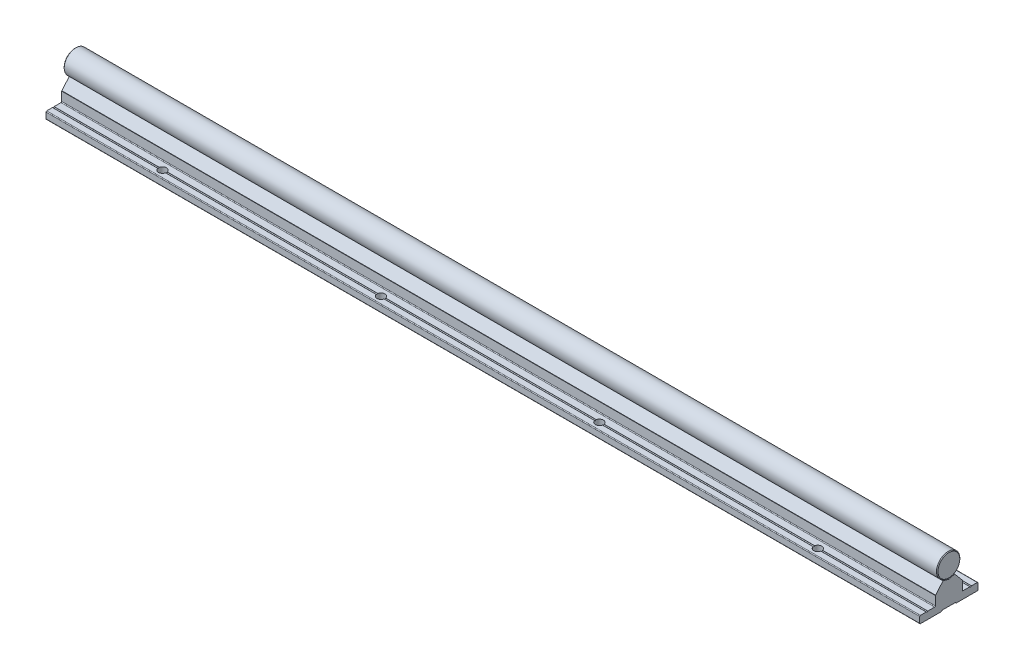
from build123d import *

# Parameters (mm, degrees)
EXTRUDE_3847_DEPTH       = 1500
SKETCH_1_3_R             = 8
EXTRUDE_3976_DEPTH       = 1500
FILLET_4_R               = 0.2
SKETCH_2_R               = 2.75
CUT_EXTRUDE_1_DEPTH      = 1501.39461476
PATTERN_LINEAR_1_COUNT   = 20
PATTERN_LINEAR_1_PITCH   = 150
PATTERN_LINEAR_2_COUNT   = 20
PATTERN_LINEAR_2_PITCH   = 150
FILLET_1_R               = 0.3
CUT_EXTRUDE_2_DEPTH      = 3
FILLET_2_R               = 0.3
PATTERN_LINEAR_3_COUNT   = 20
PATTERN_LINEAR_3_PITCH   = 150
CHAMFER_1_SIZE           = 0.5
FILLET_3_R               = 0.5
FILLET_5_R               = 0.2
FILLET_6_R               = 0.1
FILLET_7_R               = 0.1
CUT_EXTRUDE_3_DEPTH      = 1501.341627866
CUT_EXTRUDE_3_DEPTH_BACK = 1501.341627866
SKETCH_7_W               = 3500
SKETCH_7_H               = 1500
SKETCH_7_W_2             = 600
SKETCH_7_H_2             = 1000
CHAMFER_2_SIZE           = 0.5


with BuildPart() as part:
    # Эскиз1 → Extrude 3847 (new, symmetric)
    with BuildSketch(Plane(origin=(0, 0, 0), x_dir=(0, 0, -1), z_dir=(1, 0, 0))):
        Polygon((-20, -25), (-4.75, -25), (-4.75, -24.4), (4.75, -24.4), (4.75, -25), (20, -25), (20, -20), (15.5, -20), (15, -20.5), (14.5, -20), (9.25, -20), (9.25, -13.3), (9.110116754, -13.3), (4, -7.21), (3.8, -7.21), (2.309327639, -7.659439004), (0, -8.355703281), (-2.309327657, -7.659438999), (-3.8, -7.21), (-4, -7.21), (-9.110116754, -13.3), (-9.25, -13.3), (-9.25, -20), (-14.5, -20), (-15, -20.5), (-15.5, -20), (-20, -20), align=None)
    extrude(amount=EXTRUDE_3847_DEPTH, both=True)

    # Скругление4
    fillet_4_edges = [part.edges().sort_by_distance(p)[0] for p in [
        (0, -20, -15.5),
        (0, -24.4, -4.75),
        (0, -24.4, 4.75),
        (0, -20, 15.5),
        (0, -20, 14.5),
        (0, -8.355703281, 0),
        (0, -20, -14.5),
    ]]
    fillet(fillet_4_edges, radius=FILLET_4_R)

    # Эскиз2 → Вырез-Вытянуть1 (cut, through all)
    with BuildSketch(Plane(origin=(0, -20, 0), x_dir=(1, 0, 0), z_dir=(0, 1, 0))):
        with Locations(Location((-1425, -15, 0), (0, 0, 270))):
            Circle(SKETCH_2_R)
        with Locations(Location((-1425, 15, 0), (0, 0, 270))):
            Circle(SKETCH_2_R)
        with Locations(Location((-1275, -15, 0), (0, 0, 270))):
            Circle(SKETCH_2_R)
        with Locations(Location((-1275, 15, 0), (0, 0, 270))):
            Circle(SKETCH_2_R)
        with Locations(Location((-1125, -15, 0), (0, 0, 270))):
            Circle(SKETCH_2_R)
        with Locations(Location((-1125, 15, 0), (0, 0, 270))):
            Circle(SKETCH_2_R)
        with Locations(Location((-975, -15, 0), (0, 0, 270))):
            Circle(SKETCH_2_R)
        with Locations(Location((-975, 15, 0), (0, 0, 270))):
            Circle(SKETCH_2_R)
        with Locations(Location((-825, -15, 0), (0, 0, 270))):
            Circle(SKETCH_2_R)
        with Locations(Location((-825, 15, 0), (0, 0, 270))):
            Circle(SKETCH_2_R)
        with Locations(Location((-675, -15, 0), (0, 0, 270))):
            Circle(SKETCH_2_R)
        with Locations(Location((-675, 15, 0), (0, 0, 270))):
            Circle(SKETCH_2_R)
        with Locations(Location((-525, -15, 0), (0, 0, 270))):
            Circle(SKETCH_2_R)
        with Locations(Location((-525, 15, 0), (0, 0, 270))):
            Circle(SKETCH_2_R)
        with Locations(Location((-375, -15, 0), (0, 0, 270))):
            Circle(SKETCH_2_R)
        with Locations(Location((-375, 15, 0), (0, 0, 270))):
            Circle(SKETCH_2_R)
        with Locations(Location((-225, -15, 0), (0, 0, 270))):
            Circle(SKETCH_2_R)
        with Locations(Location((-225, 15, 0), (0, 0, 270))):
            Circle(SKETCH_2_R)
        with Locations(Location((-75, -15, 0), (0, 0, 270))):
            Circle(SKETCH_2_R)
        with Locations(Location((-75, 15, 0), (0, 0, 270))):
            Circle(SKETCH_2_R)
        with Locations(Location((75, -15, 0), (0, 0, 270))):
            Circle(SKETCH_2_R)
        with Locations(Location((75, 15, 0), (0, 0, 270))):
            Circle(SKETCH_2_R)
        with Locations(Location((225, -15, 0), (0, 0, 270))):
            Circle(SKETCH_2_R)
        with Locations(Location((225, 15, 0), (0, 0, 270))):
            Circle(SKETCH_2_R)
        with Locations(Location((375, -15, 0), (0, 0, 270))):
            Circle(SKETCH_2_R)
        with Locations(Location((375, 15, 0), (0, 0, 270))):
            Circle(SKETCH_2_R)
        with Locations(Location((525, -15, 0), (0, 0, 270))):
            Circle(SKETCH_2_R)
        with Locations(Location((525, 15, 0), (0, 0, 270))):
            Circle(SKETCH_2_R)
        with Locations(Location((675, -15, 0), (0, 0, 270))):
            Circle(SKETCH_2_R)
        with Locations(Location((675, 15, 0), (0, 0, 270))):
            Circle(SKETCH_2_R)
        with Locations(Location((825, -15, 0), (0, 0, 270))):
            Circle(SKETCH_2_R)
        with Locations(Location((825, 15, 0), (0, 0, 270))):
            Circle(SKETCH_2_R)
        with Locations(Location((975, -15, 0), (0, 0, 270))):
            Circle(SKETCH_2_R)
        with Locations(Location((975, 15, 0), (0, 0, 270))):
            Circle(SKETCH_2_R)
        with Locations(Location((1125, -15, 0), (0, 0, 270))):
            Circle(SKETCH_2_R)
        with Locations(Location((1125, 15, 0), (0, 0, 270))):
            Circle(SKETCH_2_R)
        with Locations(Location((1275, -15, 0), (0, 0, 270))):
            Circle(SKETCH_2_R)
        with Locations(Location((1275, 15, 0), (0, 0, 270))):
            Circle(SKETCH_2_R)
        with Locations(Location((1425, -15, 0), (0, 0, 270))):
            Circle(SKETCH_2_R)
        with Locations(Location((1425, 15, 0), (0, 0, 270))):
            Circle(SKETCH_2_R)
    extrude(amount=-CUT_EXTRUDE_1_DEPTH, mode=Mode.SUBTRACT)

    # Эскиз3 → Вырез-Повернуть1 (revolve, cut)
    with BuildSketch(Plane.XY, mode=Mode.PRIVATE) as cut_revolve_1_sk:
        Polygon((-1425, 0), (-1427.2, -1.270170592), (-1427.2, -7.5), (-1427.75, -7.5), (-1427.75, -19), (-1429.75, -19), (-1429.75, -24.4), (-1425, -24.4), align=None)
    cut_revolve_1 = revolve(cut_revolve_1_sk.sketch.rotate(Axis((-1425, 56.434869358, 0), (0, -1, 0)), 270), axis=Axis((-1425, 56.434869358, 0), (0, -1, 0)), mode=Mode.SUBTRACT)

    # Линейный массив1: Вырез-Повернуть1 ×20
    with Locations(*[(i * PATTERN_LINEAR_1_PITCH, 0, 0) for i in range(1, PATTERN_LINEAR_1_COUNT)]):
        add(cut_revolve_1, mode=Mode.SUBTRACT)

    # Скругление3
    fillet_3_edges = [part.edges().sort_by_distance(p)[0] for p in [
        (0, -20, -9.25),
        (0, -20, -20),
        (0, -25, -20),
        (0, -25, -4.75),
        (0, -25, 4.75),
        (0, -20, 9.25),
        (0, -25, 20),
        (0, -20, 20),
    ]]
    fillet(fillet_3_edges, radius=FILLET_3_R)

    # Скругление5
    fillet_5_edges = [part.edges().sort_by_distance(p)[0] for p in [
        (0, -7.21, 4),
        (0, -7.21, 3.8),
        (0, -7.21, -3.8),
        (0, -7.21, -4),
    ]]
    fillet(fillet_5_edges, radius=FILLET_5_R)

    # Скругление6
    fillet_6_edges = [part.edges().sort_by_distance(p)[0] for p in [
        (0, -13.3, 9.25),
        (0, -13.3, -9.25),
    ]]
    fillet(fillet_6_edges, radius=FILLET_6_R)

    # Скругление7
    fillet_7_edges = [part.edges().sort_by_distance(p)[0] for p in [
        (0, -13.3, 9.110116754),
        (0, -13.3, -9.110116754),
    ]]
    fillet(fillet_7_edges, radius=FILLET_7_R)


with BuildPart() as body_2:
    # Эскиз1<3> → Extrude 3976 (new, symmetric)
    with BuildSketch(Plane(origin=(0, 0, 0), x_dir=(0, 0, -1), z_dir=(1, 0, 0))):
        Circle(SKETCH_1_3_R)
    extrude(amount=EXTRUDE_3976_DEPTH, both=True)

    # Эскиз4 → Вырез-Повернуть2 (revolve, cut)
    with BuildSketch(Plane.XY, mode=Mode.PRIVATE) as cut_revolve_2_sk:
        Polygon((-1425, -10), (-1427.2, -10), (-1427.2, -1.270170592), (-1425, 0), align=None)
    cut_revolve_2 = revolve(cut_revolve_2_sk.sketch.rotate(Axis((-1425, 39.840222878, 0), (0, -1, 0)), 270), axis=Axis((-1425, 39.840222878, 0), (0, -1, 0)), mode=Mode.SUBTRACT)

    # Линейный массив2: Вырез-Повернуть2 ×20
    with Locations(*[(i * PATTERN_LINEAR_2_PITCH, 0, 0) for i in range(1, PATTERN_LINEAR_2_COUNT)]):
        add(cut_revolve_2, mode=Mode.SUBTRACT)

    # Фаска1
    chamfer_1_edges = [body_2.edges().sort_by_distance(p)[0] for p in [
        (-1500, 0, 8),
        (1500, 0, 8),
    ]]
    chamfer(chamfer_1_edges, length=CHAMFER_1_SIZE)


with BuildPart() as body_3:
    # Эскиз5 → Повернуть1 (revolve)
    with BuildSketch(Plane.XY, mode=Mode.PRIVATE) as revolve_1_sk:
        Polygon((-1425, -24), (-1429.5, -24), (-1429.5, -19), (-1427.5, -19), (-1427.5, -2.461880215), (-1426.7, -2), (-1425, -2), align=None)
    revolve(revolve_1_sk.sketch.rotate(Axis((-1425, 35.529626596, 0), (0, -1, 0)), 270), axis=Axis((-1425, 35.529626596, 0), (0, -1, 0)))

    # Скругление1
    fillet_1_edges = [body_3.edges().sort_by_distance(p)[0] for p in [
        (-1425, -19, -4.5),
    ]]
    fillet(fillet_1_edges, radius=FILLET_1_R)

    # Эскиз6 → Вырез-Вытянуть2 (cut)
    with BuildSketch(Plane.XZ.offset(24)):
        Polygon((-1423.25, -1.010362971), (-1423.25, 1.010362971), (-1425, 2.020725942), (-1426.75, 1.010362971), (-1426.75, -1.010362971), (-1425, -2.020725942), align=None)
    extrude(amount=-CUT_EXTRUDE_2_DEPTH, mode=Mode.SUBTRACT)

    # Скругление2
    fillet_2_edges = [body_3.edges().sort_by_distance(p)[0] for p in [
        (-1424.125, -24, -1.515544457),
        (-1423.25, -24, 0),
        (-1424.125, -24, 1.515544457),
        (-1425.875, -24, 1.515544457),
        (-1426.75, -24, 0),
        (-1425.875, -24, -1.515544457),
        (-1425, -24, -4.5),
    ]]
    fillet(fillet_2_edges, radius=FILLET_2_R)


with BuildPart() as pattern_linear_3_1:
    # Линейный массив3: pattern copy
    add(body_3.part.moved(Location(Vector(1, 0, 0) * (1 * PATTERN_LINEAR_3_PITCH))))


with BuildPart() as pattern_linear_3_2:
    # Линейный массив3: pattern copy
    add(body_3.part.moved(Location(Vector(1, 0, 0) * (2 * PATTERN_LINEAR_3_PITCH))))


with BuildPart() as pattern_linear_3_3:
    # Линейный массив3: pattern copy
    add(body_3.part.moved(Location(Vector(1, 0, 0) * (3 * PATTERN_LINEAR_3_PITCH))))


with BuildPart() as pattern_linear_3_4:
    # Линейный массив3: pattern copy
    add(body_3.part.moved(Location(Vector(1, 0, 0) * (4 * PATTERN_LINEAR_3_PITCH))))


with BuildPart() as pattern_linear_3_5:
    # Линейный массив3: pattern copy
    add(body_3.part.moved(Location(Vector(1, 0, 0) * (5 * PATTERN_LINEAR_3_PITCH))))


with BuildPart() as pattern_linear_3_6:
    # Линейный массив3: pattern copy
    add(body_3.part.moved(Location(Vector(1, 0, 0) * (6 * PATTERN_LINEAR_3_PITCH))))


with BuildPart() as pattern_linear_3_7:
    # Линейный массив3: pattern copy
    add(body_3.part.moved(Location(Vector(1, 0, 0) * (7 * PATTERN_LINEAR_3_PITCH))))


with BuildPart() as pattern_linear_3_8:
    # Линейный массив3: pattern copy
    add(body_3.part.moved(Location(Vector(1, 0, 0) * (8 * PATTERN_LINEAR_3_PITCH))))


with BuildPart() as pattern_linear_3_9:
    # Линейный массив3: pattern copy
    add(body_3.part.moved(Location(Vector(1, 0, 0) * (9 * PATTERN_LINEAR_3_PITCH))))


with BuildPart() as pattern_linear_3_10:
    # Линейный массив3: pattern copy
    add(body_3.part.moved(Location(Vector(1, 0, 0) * (10 * PATTERN_LINEAR_3_PITCH))))


with BuildPart() as pattern_linear_3_11:
    # Линейный массив3: pattern copy
    add(body_3.part.moved(Location(Vector(1, 0, 0) * (11 * PATTERN_LINEAR_3_PITCH))))


with BuildPart() as pattern_linear_3_12:
    # Линейный массив3: pattern copy
    add(body_3.part.moved(Location(Vector(1, 0, 0) * (12 * PATTERN_LINEAR_3_PITCH))))


with BuildPart() as pattern_linear_3_13:
    # Линейный массив3: pattern copy
    add(body_3.part.moved(Location(Vector(1, 0, 0) * (13 * PATTERN_LINEAR_3_PITCH))))


with BuildPart() as pattern_linear_3_14:
    # Линейный массив3: pattern copy
    add(body_3.part.moved(Location(Vector(1, 0, 0) * (14 * PATTERN_LINEAR_3_PITCH))))


with BuildPart() as pattern_linear_3_15:
    # Линейный массив3: pattern copy
    add(body_3.part.moved(Location(Vector(1, 0, 0) * (15 * PATTERN_LINEAR_3_PITCH))))


with BuildPart() as pattern_linear_3_16:
    # Линейный массив3: pattern copy
    add(body_3.part.moved(Location(Vector(1, 0, 0) * (16 * PATTERN_LINEAR_3_PITCH))))


with BuildPart() as pattern_linear_3_17:
    # Линейный массив3: pattern copy
    add(body_3.part.moved(Location(Vector(1, 0, 0) * (17 * PATTERN_LINEAR_3_PITCH))))


with BuildPart() as pattern_linear_3_18:
    # Линейный массив3: pattern copy
    add(body_3.part.moved(Location(Vector(1, 0, 0) * (18 * PATTERN_LINEAR_3_PITCH))))


with BuildPart() as pattern_linear_3_19:
    # Линейный массив3: pattern copy
    add(body_3.part.moved(Location(Vector(1, 0, 0) * (19 * PATTERN_LINEAR_3_PITCH))))


with BuildPart() as cut_extrude_3_tool:
    # Эскиз7 → Вырез-Вытянуть3 (new, two sides: drawn at the far end of the back side and taken through both)
    with BuildSketch(Plane(origin=(0, 0, 0), x_dir=(1, 0, 0), z_dir=(0, 1, 0)).offset(-CUT_EXTRUDE_3_DEPTH_BACK)):
        Rectangle(SKETCH_7_W, SKETCH_7_H)
        Rectangle(SKETCH_7_W_2, SKETCH_7_H_2, mode=Mode.SUBTRACT)
    extrude(amount=CUT_EXTRUDE_3_DEPTH + CUT_EXTRUDE_3_DEPTH_BACK)


with BuildPart() as part_1:
    add(part.part)

    # Вырез-Вытянуть3: cut by cut_extrude_3_tool
    add(cut_extrude_3_tool.part, mode=Mode.SUBTRACT)


with BuildPart() as body_2_1:
    add(body_2.part)

    # Вырез-Вытянуть3: cut by cut_extrude_3_tool
    add(cut_extrude_3_tool.part, mode=Mode.SUBTRACT)

    # Фаска2
    chamfer_2_edges = [body_2_1.edges().sort_by_distance(p)[0] for p in [
        (-300, 0, 8),
        (300, 0, 8),
    ]]
    chamfer(chamfer_2_edges, length=CHAMFER_2_SIZE)


with BuildPart() as body_3_1:
    add(body_3.part)

    # Вырез-Вытянуть3: cut by cut_extrude_3_tool
    add(cut_extrude_3_tool.part, mode=Mode.SUBTRACT)


with BuildPart() as pattern_linear_3_1_1:
    add(pattern_linear_3_1.part)

    # Вырез-Вытянуть3: cut by cut_extrude_3_tool
    add(cut_extrude_3_tool.part, mode=Mode.SUBTRACT)


with BuildPart() as pattern_linear_3_2_1:
    add(pattern_linear_3_2.part)

    # Вырез-Вытянуть3: cut by cut_extrude_3_tool
    add(cut_extrude_3_tool.part, mode=Mode.SUBTRACT)


with BuildPart() as pattern_linear_3_3_1:
    add(pattern_linear_3_3.part)

    # Вырез-Вытянуть3: cut by cut_extrude_3_tool
    add(cut_extrude_3_tool.part, mode=Mode.SUBTRACT)


with BuildPart() as pattern_linear_3_4_1:
    add(pattern_linear_3_4.part)

    # Вырез-Вытянуть3: cut by cut_extrude_3_tool
    add(cut_extrude_3_tool.part, mode=Mode.SUBTRACT)


with BuildPart() as pattern_linear_3_5_1:
    add(pattern_linear_3_5.part)

    # Вырез-Вытянуть3: cut by cut_extrude_3_tool
    add(cut_extrude_3_tool.part, mode=Mode.SUBTRACT)


with BuildPart() as pattern_linear_3_6_1:
    add(pattern_linear_3_6.part)

    # Вырез-Вытянуть3: cut by cut_extrude_3_tool
    add(cut_extrude_3_tool.part, mode=Mode.SUBTRACT)


with BuildPart() as pattern_linear_3_7_1:
    add(pattern_linear_3_7.part)

    # Вырез-Вытянуть3: cut by cut_extrude_3_tool
    add(cut_extrude_3_tool.part, mode=Mode.SUBTRACT)


with BuildPart() as pattern_linear_3_12_1:
    add(pattern_linear_3_12.part)

    # Вырез-Вытянуть3: cut by cut_extrude_3_tool
    add(cut_extrude_3_tool.part, mode=Mode.SUBTRACT)


with BuildPart() as pattern_linear_3_13_1:
    add(pattern_linear_3_13.part)

    # Вырез-Вытянуть3: cut by cut_extrude_3_tool
    add(cut_extrude_3_tool.part, mode=Mode.SUBTRACT)


with BuildPart() as pattern_linear_3_14_1:
    add(pattern_linear_3_14.part)

    # Вырез-Вытянуть3: cut by cut_extrude_3_tool
    add(cut_extrude_3_tool.part, mode=Mode.SUBTRACT)


with BuildPart() as pattern_linear_3_15_1:
    add(pattern_linear_3_15.part)

    # Вырез-Вытянуть3: cut by cut_extrude_3_tool
    add(cut_extrude_3_tool.part, mode=Mode.SUBTRACT)


with BuildPart() as pattern_linear_3_16_1:
    add(pattern_linear_3_16.part)

    # Вырез-Вытянуть3: cut by cut_extrude_3_tool
    add(cut_extrude_3_tool.part, mode=Mode.SUBTRACT)


with BuildPart() as pattern_linear_3_17_1:
    add(pattern_linear_3_17.part)

    # Вырез-Вытянуть3: cut by cut_extrude_3_tool
    add(cut_extrude_3_tool.part, mode=Mode.SUBTRACT)


with BuildPart() as pattern_linear_3_18_1:
    add(pattern_linear_3_18.part)

    # Вырез-Вытянуть3: cut by cut_extrude_3_tool
    add(cut_extrude_3_tool.part, mode=Mode.SUBTRACT)


with BuildPart() as pattern_linear_3_19_1:
    add(pattern_linear_3_19.part)

    # Вырез-Вытянуть3: cut by cut_extrude_3_tool
    add(cut_extrude_3_tool.part, mode=Mode.SUBTRACT)


solid = Compound([pattern_linear_3_8.part, pattern_linear_3_9.part, pattern_linear_3_10.part, pattern_linear_3_11.part, part_1.part, body_2_1.part])
